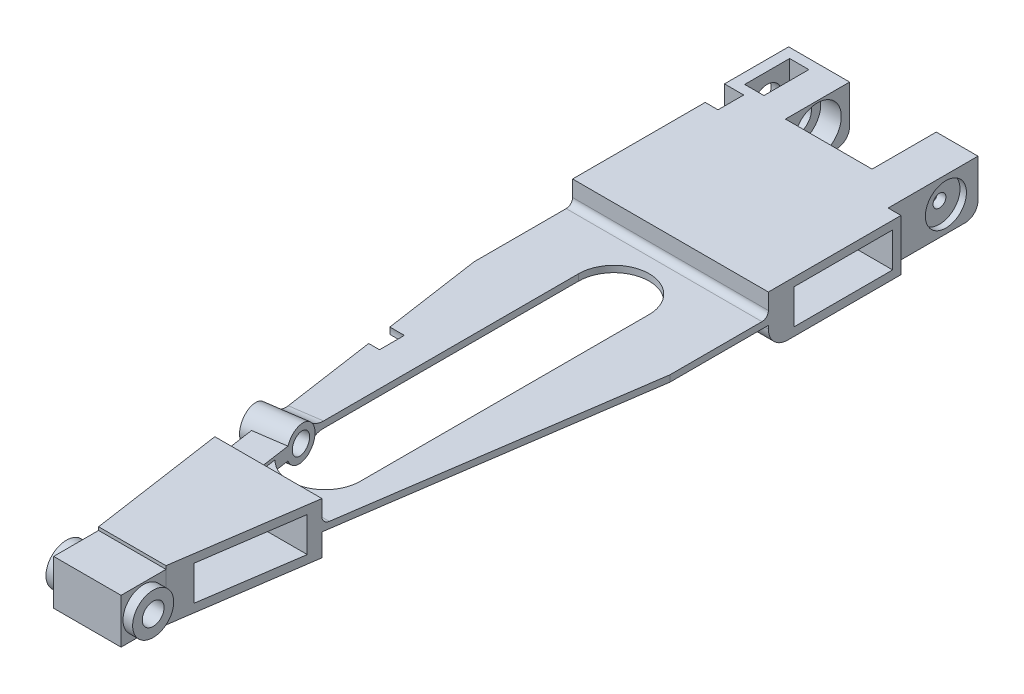
from build123d import *

# Parameters (mm, degrees)
JOINTTIBIA_DEPTH           = 3.5
JOINTTIBIA_DEPTH_BACK      = 3.5
ESQUISSE2_W                = 13.5
ESQUISSE2_H                = 7
ESQUISSE3_R                = 1.7
HOLEAXETIBIA_DEPTH         = 14.5
ESQUISSE4_R                = 5.505678288
ESQUISSE4_R_2              = 3.2
ENTRETOISETIBIA_DEPTH      = 1.5
SHAPEJOINTCOXA_DEPTH       = 4
SHAPEJOINTCOXA_DEPTH_BACK  = 4
ESQUISSE6_R                = 3.2
HOLEMAGNET_DEPTH           = 1
ESQUISSE7_R                = 2.25
HOLEAXE_DEPTH              = 8
ESQUISSE9_R                = 3.7
HOLEBEARING_DEPTH          = 3.2
ESQUISSE10_R               = 2.25
ENTRETOISEBEARING_DEPTH    = 1
ESQUISSE12_W               = 10
ESQUISSE12_H               = 8
ESQUISSE12_R               = 2.25
EXTSCREWLESS_DEPTH         = 3
ESQUISSE13_W               = 3
ESQUISSE13_H               = 7
SCEWLESSLOCKER_DEPTH       = 10
ESQUISSE24_W               = 30.5
ESQUISSE24_H               = 8
SHAPE_BDY_DEPTH            = 104.5
TRIANGULIZE_DEPTH          = 10
ESQUISSE27_W               = 15.4
ESQUISSE27_H               = 5.4
ATTACHWINGS_DEPTH          = 10
ESQUISSE29_W               = 62.63923601
ESQUISSE29_H               = 9.700813627
VOID_BODY_DEPTH            = 38
MASS_REMOVER_PCB_DEPTH     = 10
CONG_1_R                   = 5
CONG_2_R                   = 3
ESQUISSE32_W               = 15.4
ESQUISSE32_H               = 5.4
LOCKERHOLE_DEPTH           = 32
FIXATIONSENSOR_DEPTH       = 1.5
FIXATIONSENSOR_DEPTH_BACK  = 5
ESQUISSE33_R               = 2.6
ESQUISSE34_R               = 1.6
SCREWFIXATIONSENSOR_DEPTH  = 10
ESQUISSE35_W               = 8
ESQUISSE35_H               = 2
FIXATIONSENSORRENFOR_DEPTH = 5
CONG_3_R                   = 3
CONG_4_R                   = 2
CONG_5_R                   = 2
CONG_6_R                   = 1
ESQUISSE36_R               = 2
ENL_V_MAT_EXTRU_1_DEPTH    = 4.5
ESQUISSE38_R               = 1
REMOVER_HELPER_DEPTH       = 10


with BuildPart() as part:
    # Esquisse2 → JointTibia (new, two sides: drawn at the far end of the back side and taken through both)
    with BuildSketch(Plane(origin=(0, 0, 0), x_dir=(1, 0, 0), z_dir=(0, 1, 0)).offset(-JOINTTIBIA_DEPTH_BACK)):
        Rectangle(ESQUISSE2_W, ESQUISSE2_H)
    extrude(amount=JOINTTIBIA_DEPTH + JOINTTIBIA_DEPTH_BACK)

    # Esquisse3 → HoleAxeTibia (cut)
    with BuildSketch(Plane(origin=(6.75, 0, 0), x_dir=(0, 0, -1), z_dir=(1, 0, 0))):
        Circle(ESQUISSE3_R)
    extrude(amount=-HOLEAXETIBIA_DEPTH, mode=Mode.SUBTRACT)

    # Esquisse4 → EntretoiseTibia (cut)
    with BuildSketch(Plane(origin=(6.75, 0, 0), x_dir=(0, 0, -1), z_dir=(1, 0, 0))):
        Circle(ESQUISSE4_R)
        Circle(ESQUISSE4_R_2, mode=Mode.SUBTRACT)
    entretoisetibia = extrude(amount=-ENTRETOISETIBIA_DEPTH, mode=Mode.SUBTRACT)

    # Symétrie1: EntretoiseTibia across plane
    add(entretoisetibia.mirror(Plane(origin=(0, 0, 0), x_dir=(0, 0, 1), z_dir=(1, 0, 0))), mode=Mode.SUBTRACT)



with BuildPart() as body_2:
    # Esquisse5 → ShapeJointCoxa (new, two sides: drawn at the far end of the back side and taken through both)
    with BuildSketch(Plane(origin=(0, 0, 0), x_dir=(1, 0, 0), z_dir=(0, 1, 0)).offset(-SHAPEJOINTCOXA_DEPTH_BACK)):
        Polygon((-13.25, 112), (-13.25, 122), (-6.75, 122), (-6.75, 112), (6.75, 112), (6.75, 122), (13.25, 122), (13.25, 112), (13.25, 108), (-13.25, 108), align=None)
    extrude(amount=SHAPEJOINTCOXA_DEPTH + SHAPEJOINTCOXA_DEPTH_BACK)

    # Esquisse6 → HoleMagnet (cut)
    with BuildSketch(Plane(origin=(13.25, 0, 0), x_dir=(0, 0, -1), z_dir=(1, 0, 0))):
        with Locations((117, 0)):
            Circle(ESQUISSE6_R)
    extrude(amount=-HOLEMAGNET_DEPTH, mode=Mode.SUBTRACT)

    # Esquisse7 → HoleAxe (cut)
    with BuildSketch(Plane.ZY.offset(13.25)):
        with Locations((-117, 0)):
            Circle(ESQUISSE7_R)
    extrude(amount=-HOLEAXE_DEPTH, mode=Mode.SUBTRACT)

    # Esquisse9 → HoleBearing (cut)
    with BuildSketch(Plane.ZY.offset(-6.75)):
        with Locations((-117, 0)):
            Circle(ESQUISSE9_R)
    holebearing = extrude(amount=-HOLEBEARING_DEPTH, mode=Mode.SUBTRACT)

    # Symétrie2: HoleBearing across plane
    add(holebearing.mirror(Plane(origin=(0, 0, 0), x_dir=(0, 0, 1), z_dir=(1, 0, 0))), mode=Mode.SUBTRACT)

    # Esquisse10 → EntretoiseBearing (cut)
    with BuildSketch(Plane.ZY.offset(-9.95)):
        with Locations((-117, 0)):
            Circle(ESQUISSE10_R)
    extrude(amount=-ENTRETOISEBEARING_DEPTH, mode=Mode.SUBTRACT)

    # Esquisse12 → ExtScrewLess (add)
    with BuildSketch(Plane.ZY.offset(13.25)):
        with Locations((-117, 0)):
            Rectangle(ESQUISSE12_W, ESQUISSE12_H)
        with Locations((-117, 0)):
            Circle(ESQUISSE12_R, mode=Mode.SUBTRACT)
    extrude(amount=EXTSCREWLESS_DEPTH)

    # Esquisse13 → ScewLessLocker (cut)
    with BuildSketch(Plane(origin=(0, 4, 0), x_dir=(1, 0, 0), z_dir=(0, 1, 0))):
        with Locations((-13.1, 117)):
            Rectangle(ESQUISSE13_W, ESQUISSE13_H)
    extrude(amount=-SCEWLESSLOCKER_DEPTH, mode=Mode.SUBTRACT)


with BuildPart() as part_1:
    add(part.part)

    add(body_2.part)  # Shape_bdy merges body 2
    # Esquisse24 → Shape_bdy (add)
    with BuildSketch(Plane.XY.offset(-108)):
        Rectangle(ESQUISSE24_W, ESQUISSE24_H)
    extrude(amount=SHAPE_BDY_DEPTH)

    # Esquisse26 → Triangulize (cut)
    with BuildSketch(Plane.XZ.offset(4)):
        Polygon((-5.25, -3.5), (-15.25, -72), (-15.25, -3.5), align=None)
        Polygon((5.25, -3.5), (15.25, -3.5), (15.25, -72), align=None)
    extrude(amount=-TRIANGULIZE_DEPTH, mode=Mode.SUBTRACT)

    # Esquisse27 → AttachWings (cut)
    with BuildSketch(Plane(origin=(15.25, 0, 0), x_dir=(0, 0, -1), z_dir=(1, 0, 0))):
        with Locations((99, 0)):
            Rectangle(ESQUISSE27_W, ESQUISSE27_H)
        with Locations((15, 0)):
            Rectangle(ESQUISSE27_W, ESQUISSE27_H)
    attachwings = extrude(amount=-ATTACHWINGS_DEPTH, mode=Mode.SUBTRACT)

    # Symétrie4: AttachWings across plane
    add(attachwings.mirror(Plane(origin=(0, 0, 0), x_dir=(0, 0, 1), z_dir=(1, 0, 0))), mode=Mode.SUBTRACT)

    # Esquisse29 → Void body (cut)
    with BuildSketch(Plane(origin=(15.25, 0, 0), x_dir=(0, 0, -1), z_dir=(1, 0, 0))):
        with Locations((56.023105982, 5.350406814)):
            Rectangle(ESQUISSE29_W, ESQUISSE29_H)
        with Locations((56.023105982, -5.350406814)):
            Rectangle(ESQUISSE29_W, ESQUISSE29_H)
    extrude(amount=-VOID_BODY_DEPTH, mode=Mode.SUBTRACT)

    # Esquisse30 → Mass remover & PCB (cut)
    with BuildSketch(Plane(origin=(0, 0.5, 0), x_dir=(1, 0, 0), z_dir=(0, 1, 0))):
        with BuildLine():
            Line((5.5, 78.523105982), (5.5, 33.523105982))
            ThreePointArc((5.5, 33.523105982), (0, 28.023105982), (-5.5, 33.523105982))
            Line((-5.5, 33.523105982), (-5.5, 78.523105982))
            ThreePointArc((-5.5, 78.523105982), (0, 84.023105982), (5.5, 78.523105982))
        make_face()
    extrude(amount=-MASS_REMOVER_PCB_DEPTH, mode=Mode.SUBTRACT)

    # Congé1
    cong_1_edges = [part_1.edges().sort_by_distance(p)[0] for p in [
        (0, -4, -112),
    ]]
    fillet(cong_1_edges, radius=CONG_1_R)

    # Congé2
    cong_2_edges = [part_1.edges().sort_by_distance(p)[0] for p in [
        (0, -4, -87.342723987),
    ]]
    fillet(cong_2_edges, radius=CONG_2_R)

    # Esquisse32 → LockerHole (cut)
    with BuildSketch(Plane(origin=(5.25, 0, 0), x_dir=(0, 0, -1), z_dir=(1, 0, 0))):
        with Locations((99, 0)):
            Rectangle(ESQUISSE32_W, ESQUISSE32_H)
        with Locations((15, 0)):
            Rectangle(ESQUISSE32_W, ESQUISSE32_H)
    extrude(amount=-LOCKERHOLE_DEPTH, mode=Mode.SUBTRACT)

    # Esquisse33 → FixationSensor (add, two sides: drawn at the far end of the back side and taken through both)
    with BuildSketch(Plane(origin=(-4.640161198, 0, 0.677395795), x_dir=(0.14445423110427463, 0, 0.989511483064281), z_dir=(-0.989511483064281, 0, 0.14445423110427463)).offset(-FIXATIONSENSOR_DEPTH_BACK)):
        with Locations((-34.81506606, 0)):
            Circle(ESQUISSE33_R)
    extrude(amount=FIXATIONSENSOR_DEPTH + FIXATIONSENSOR_DEPTH_BACK)

    # Esquisse34 → ScrewFixationSensor (cut)
    with BuildSketch(Plane(origin=(-6.124428422, 0, 0.894077142), x_dir=(0.14445423110427466, 0, 0.989511483064281), z_dir=(-0.989511483064281, 0, 0.14445423110427466))):
        with Locations((-34.81506606, 0)):
            Circle(ESQUISSE34_R)
    extrude(amount=-SCREWFIXATIONSENSOR_DEPTH, mode=Mode.SUBTRACT)

    # Esquisse35 → FixationSensorRenfor (add)
    with BuildSketch(Plane(origin=(-4.640161198, 0, 0.677395795), x_dir=(0.14445423110427463, 0, 0.989511483064281), z_dir=(-0.989511483064281, 0, 0.14445423110427463))):
        with Locations((-28.41506606, 0)):
            Rectangle(ESQUISSE35_W, ESQUISSE35_H)
    extrude(amount=-FIXATIONSENSORRENFOR_DEPTH)

    # Congé3
    cong_3_edges = [part_1.edges().sort_by_distance(p)[0] for p in [
        (-7.768957729, 0.5, -36.628455586),
        (-7.768957729, -0.5, -36.628455586),
    ]]
    fillet(cong_3_edges, radius=CONG_3_R)

    # Congé4
    # the kernel refuses this fillet: 2 mm, written as the material it takes off along each edge
    with BuildSketch(Plane(origin=(1.75, -4, -122), x_dir=(0, 0, 1), z_dir=(1, 0, 0))) as cong_4_piece_1:
        with BuildLine():
            CenterArc((CONG_4_R, -CONG_4_R), CONG_4_R, 90, 90)
            Line((0, -CONG_4_R), (0, 0))
            Line((0, 0), (CONG_4_R, 0))
        make_face()
    extrude(amount=16.5, mode=Mode.SUBTRACT)
    with BuildSketch(Plane(origin=(-21.25, -4, -122), x_dir=(0, 0, 1), z_dir=(1, 0, 0))) as cong_4_piece_2:
        with BuildLine():
            CenterArc((CONG_4_R, -CONG_4_R), CONG_4_R, 90, 90)
            Line((0, -CONG_4_R), (0, 0))
            Line((0, 0), (CONG_4_R, 0))
        make_face()
    extrude(amount=19.5, mode=Mode.SUBTRACT)

    # Congé5
    cong_5_edges = [part_1.edges().sort_by_distance(p)[0] for p in [
        (-5.818900475, 1, -24.703487977),
        (-5.818900475, -1, -24.703487977),
    ]]
    fillet(cong_5_edges, radius=CONG_5_R)

    # Congé6
    cong_6_edges = [part_1.edges().sort_by_distance(p)[0] for p in [
        (0, 0.5, -87.342723987),
        (2.52649923, 0.5, -24.703487977),
    ]]
    fillet(cong_6_edges, radius=CONG_6_R)

    # Esquisse36 → Enlèv. mat.-Extru.1 (cut)
    with BuildSketch(Plane.ZY.offset(15.25)):
        with Locations((-54.7, 0)):
            Circle(ESQUISSE36_R)
    extrude(amount=-ENL_V_MAT_EXTRU_1_DEPTH, mode=Mode.SUBTRACT)

    # Esquisse38 → Remover helper (cut)
    with BuildSketch(Plane(origin=(12.25, 0, 0), x_dir=(0, 0, -1), z_dir=(1, 0, 0))):
        with Locations((117, 0)):
            Circle(ESQUISSE38_R)
    extrude(amount=-REMOVER_HELPER_DEPTH, mode=Mode.SUBTRACT)


solid = part_1.part
